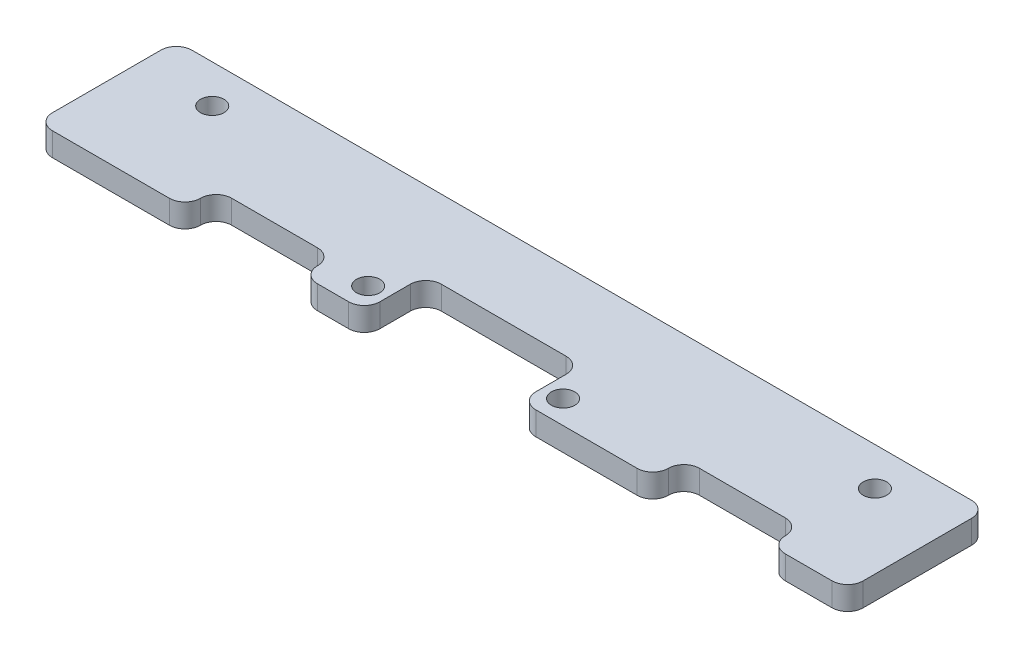
from build123d import *

# Parameters (mm, degrees)
SKETCH_1_R          = 1.5
EXTRUDE_1_DEPTH     = 3
SKETCH_2_W          = 15
SKETCH_2_H          = 4
CUT_EXTRUDE_1_DEPTH = 3
FILLET_1_R          = 2


with BuildPart() as part:
    # 草图1 → 凸台-拉伸1 (new body)
    with BuildSketch(Plane(origin=(0, 0, 0), x_dir=(1, 0, 0), z_dir=(0, 1, 0))):
        Polygon((-52, 0), (52, 0), (52, -17.9), (10, -17.9), (10, -10), (-10, -10), (-10, -17.9), (-52, -17.9), align=None)
        with Locations(Location((-12.5, -14.9, 0), (0, 0, 270))):
            Circle(SKETCH_1_R, mode=Mode.SUBTRACT)
        with Locations(Location((12.5, -14.9, 0), (0, 0, 90))):
            Circle(SKETCH_1_R, mode=Mode.SUBTRACT)
        with Locations(Location((-42.5, -4.9, 0), (0, 0, 270))):
            Circle(SKETCH_1_R, mode=Mode.SUBTRACT)
        with Locations(Location((42.5, -4.9, 0), (0, 0, 90))):
            Circle(SKETCH_1_R, mode=Mode.SUBTRACT)
    extrude(amount=EXTRUDE_1_DEPTH)

    # 草图2 → 切除-拉伸1 (cut)
    with BuildSketch(Plane(origin=(0, 3, 0), x_dir=(1, 0, 0), z_dir=(0, 1, 0))):
        with Locations((-25.5, -15.9)):
            Rectangle(SKETCH_2_W, SKETCH_2_H)
        with Locations((34.5, -15.9)):
            Rectangle(SKETCH_2_W, SKETCH_2_H)
    extrude(amount=-CUT_EXTRUDE_1_DEPTH, mode=Mode.SUBTRACT)

    # 圆角1
    fillet_1_edges = [part.edges().sort_by_distance(p)[0] for p in [
        (52, 1.5, 17.9),
        (10, 1.5, 17.9),
        (10, 1.5, 10),
        (-10, 1.5, 10),
        (-10, 1.5, 17.9),
        (-52, 1.5, 17.9),
        (52, 1.5, 0),
        (-52, 1.5, 0),
        (-33, 1.5, 13.9),
        (-18, 1.5, 13.9),
        (-18, 1.5, 17.9),
        (27, 1.5, 17.9),
        (27, 1.5, 13.9),
        (42, 1.5, 13.9),
        (42, 1.5, 17.9),
        (-33, 1.5, 17.9),
    ]]
    fillet(fillet_1_edges, radius=FILLET_1_R - 0.0001)  # a hair under: the kernel refuses the full size


solid = part.part
